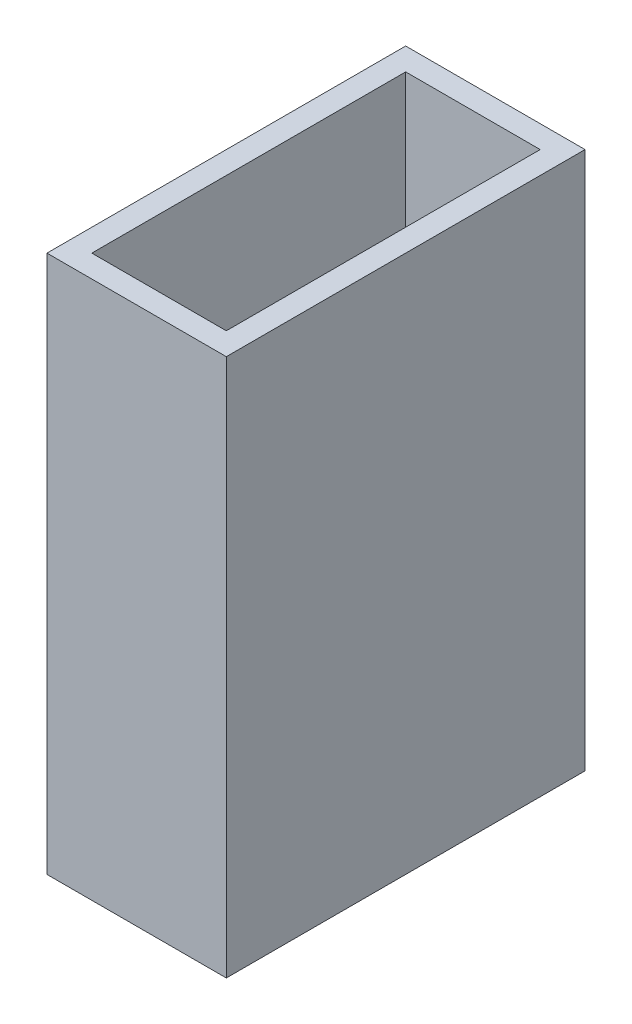
from build123d import *

# Parameters (mm, degrees)
SKETCH1_W           = 25.4
SKETCH1_H           = 50.8
SKETCH1_W_2         = 19.05
SKETCH1_H_2         = 44.45
BOSS_EXTRUDE1_DEPTH = 76.2


with BuildPart() as part:
    # Sketch1 → Boss-Extrude1 (new body)
    with BuildSketch(Plane(origin=(0, 0, 0), x_dir=(1, 0, 0), z_dir=(0, 1, 0))):
        Rectangle(SKETCH1_W, SKETCH1_H)
        Rectangle(SKETCH1_W_2, SKETCH1_H_2, mode=Mode.SUBTRACT)
    extrude(amount=BOSS_EXTRUDE1_DEPTH)


solid = part.part
